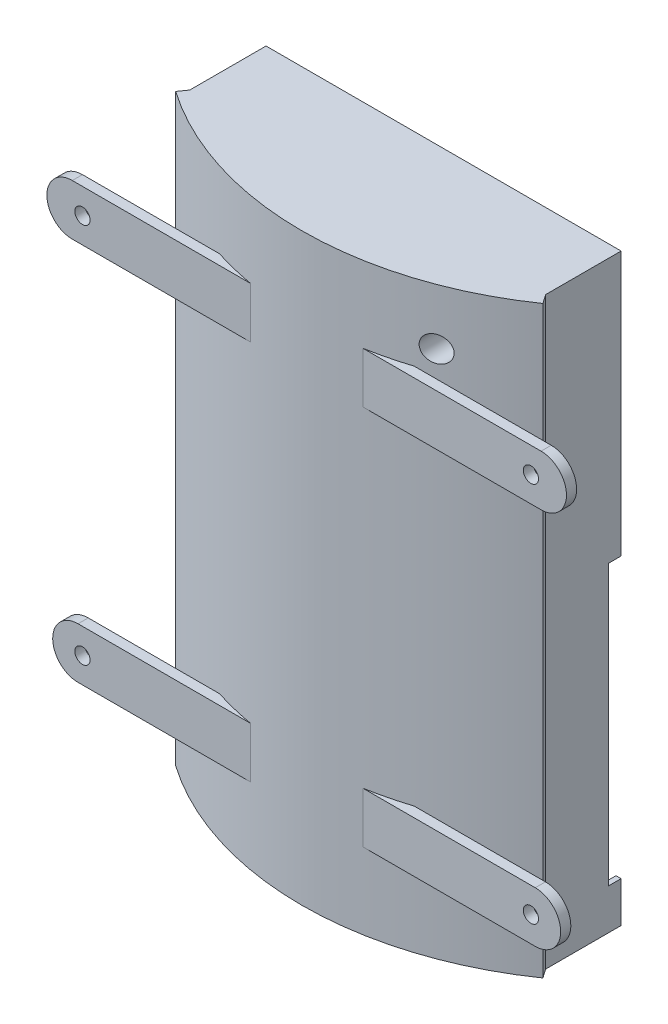
from build123d import *

# Parameters (mm, degrees)
SURFACE_EXTRUDE2_1_DEPTH = 115
THICKEN3_T2              = 2
BOSS_EXTRUDE2_REACH      = 890.848
SKETCH11_W               = 70
SKETCH11_H               = 115
BOSS_EXTRUDE7_DEPTH      = 2
SKETCH17_W               = 2.5
SKETCH17_H               = 115
BOSS_EXTRUDE8_DEPTH      = 15
SKETCH22_W               = 1.5
SKETCH22_H               = 105
CUT_EXTRUDE1_DEPTH       = 5
SKETCH23_W               = 64.9
SKETCH23_H               = 2
BOSS_EXTRUDE9_DEPTH      = 15
SKETCH25_W               = 64.9
SKETCH25_H               = 3.5
BOSS_EXTRUDE10_DEPTH     = 15
SKETCH26_W               = 20
SKETCH26_H               = 1.5
CUT_EXTRUDE3_DEPTH       = 15
SKETCH27_W               = 5
SKETCH27_H               = 9
CUT_EXTRUDE4_DEPTH       = 1.1
SKETCH29_W               = 2.5
SKETCH29_H               = 55
CUT_EXTRUDE6_DEPTH       = 1
CUT_EXTRUDE7_REACH       = 905.754
CUT_EXTRUDE7_END_RADIUS  = 63.3
SKETCH30_R               = 2.5
FILLET1_R                = 1
CUT_EXTRUDE8_REACH       = 909.037
SKETCH31_W               = 35
SKETCH31_H               = 3
CUT_EXTRUDE9_REACH       = 905.975
SKETCH32_R               = 1.5
SKETCH33_W               = 1.5
SKETCH33_H               = 5.890969975
BOSS_EXTRUDE11_DEPTH     = 1.5
MIRROR24_COPY_1_REACH    = 905.975
MIRROR24_COPY_1_SKETCH_R = 1.5


with BuildPart() as body_1:
    # Surface-Extrude2: a surface, the sketch's curves swept straight by 115 mm
    with BuildLine(Plane(origin=(0, 0, 0), x_dir=(1, 0, 0), z_dir=(0, 1, 0)), mode=Mode.PRIVATE) as surface_extrude2_1_path:
        ThreePointArc((-880.139667207, 63.554736355), (-845.139667207, 52.580574649), (-810.139667207, 63.554736355))
    surface_extrude2_1 = Shell.extrude(surface_extrude2_1_path.wire(), (0 * SURFACE_EXTRUDE2_1_DEPTH, 1 * SURFACE_EXTRUDE2_1_DEPTH, 0 * SURFACE_EXTRUDE2_1_DEPTH))
    add(Solid.thicken(surface_extrude2_1, -THICKEN3_T2))

    # Sketch11 → Boss-Extrude2 (add, up to next)
    with BuildSketch(Plane(origin=(0, 0, -63.554736355), x_dir=(-1, 0, 0), z_dir=(0, 0, -1)), mode=Mode.PRIVATE) as boss_extrude2_sk1:
        with Locations((845.139667207, 57.5)):
            Rectangle(SKETCH11_W, SKETCH11_H)
    boss_extrude2_tool1 = extrude(boss_extrude2_sk1.sketch, amount=-BOSS_EXTRUDE2_REACH, mode=Mode.PRIVATE) - body_1.part
    add(boss_extrude2_tool1.solids().sort_by_distance((-845.139667, 57.5, -63.554736))[0])

    # Sketch15 → Boss-Extrude7 (add)
    with BuildSketch(Plane(origin=(0, 0, -51.554736355), x_dir=(-1, 0, 0), z_dir=(0, 0, -1))):
        with BuildLine():
            Line((890.139667207, 24.998904399), (845.139667207, 24.998904399))
            Line((845.139667207, 24.998904399), (845.139667207, 15))
            Line((845.139667207, 15), (889.991644173, 15))
            ThreePointArc((889.991644173, 15), (895.139667207, 19.924336912), (890.139667207, 24.998904399))
        make_face()
        with BuildLine():
            Line((891.281592166, 100), (845.139667207, 100))
            Line((845.139667207, 100), (845.139667207, 90.00121851))
            Line((845.139667207, 90.00121851), (891.171212738, 90.00121851))
            ThreePointArc((891.171212738, 90.00121851), (896.281287529, 94.944806923), (891.281592166, 100))
        make_face()
    boss_extrude7 = extrude(amount=BOSS_EXTRUDE7_DEPTH)

    # Mirror20: Boss-Extrude7 across plane
    add(boss_extrude7.mirror(Plane.ZY.offset(845.139667207)))

    # Sketch17 → Boss-Extrude8 (add)
    with BuildSketch(Plane(origin=(0, 0, -63.554736355), x_dir=(-1, 0, 0), z_dir=(0, 0, -1))):
        with Locations((878.889667207, 57.5)):
            Rectangle(SKETCH17_W, SKETCH17_H)
        with Locations((811.489667207, 57.5)):
            Rectangle(SKETCH17_W, SKETCH17_H)
    extrude(amount=BOSS_EXTRUDE8_DEPTH)

    # Sketch22 → Cut-Extrude1 (cut)
    with BuildSketch(Plane(origin=(0, 0, -78.554736355), x_dir=(-1, 0, 0), z_dir=(0, 0, -1))):
        with Locations((811.989667207, 55.5)):
            Rectangle(SKETCH22_W, SKETCH22_H)
    cut_extrude1 = extrude(amount=-CUT_EXTRUDE1_DEPTH, mode=Mode.SUBTRACT)

    # Mirror21: Cut-Extrude1 across plane
    add(cut_extrude1.mirror(Plane.ZY.offset(845.139667207)), mode=Mode.SUBTRACT)

    # Sketch23 → Boss-Extrude9 (add)
    with BuildSketch(Plane(origin=(0, 0, -63.554736355), x_dir=(-1, 0, 0), z_dir=(0, 0, -1))):
        with Locations((845.189667207, 114)):
            Rectangle(SKETCH23_W, SKETCH23_H)
        with Locations((845.189667207, 110)):
            Rectangle(SKETCH23_W, SKETCH23_H)
    extrude(amount=BOSS_EXTRUDE9_DEPTH)

    # Sketch25 → Boss-Extrude10 (add)
    with BuildSketch(Plane(origin=(0, 0, -63.554736355), x_dir=(-1, 0, 0), z_dir=(0, 0, -1))):
        with Locations((845.189667207, 1.75)):
            Rectangle(SKETCH25_W, SKETCH25_H)
    extrude(amount=BOSS_EXTRUDE10_DEPTH)

    # Sketch26 → Cut-Extrude3 (cut)
    with BuildSketch(Plane(origin=(0, 0, -78.554736355), x_dir=(-1, 0, 0), z_dir=(0, 0, -1))):
        with Locations((825.239667207, 1.75)):
            Rectangle(SKETCH26_W, SKETCH26_H)
    extrude(amount=-CUT_EXTRUDE3_DEPTH, mode=Mode.SUBTRACT)

    # Sketch27 → Cut-Extrude4 (cut)
    with BuildSketch(Plane.ZY.offset(880.139667207)):
        with Locations((-75.146974965, 83)):
            Rectangle(SKETCH27_W, SKETCH27_H)
    extrude(amount=-CUT_EXTRUDE4_DEPTH, mode=Mode.SUBTRACT)

    # Sketch29 → Cut-Extrude6 (cut)
    with BuildSketch(Plane(origin=(-810.239667207, 0, 0), x_dir=(0, 0, -1), z_dir=(1, 0, 0))):
        with Locations((77.304736355, 35.5)):
            Rectangle(SKETCH29_W, SKETCH29_H)
    extrude(amount=-CUT_EXTRUDE6_DEPTH, mode=Mode.SUBTRACT)

    # Cut-Extrude7: up to this cylinder (the profile starts inside it)
    cut_extrude7_end = Plane(origin=(-845.139667207, 104, -113.880574649), z_dir=(0, 1, 0)) * Cylinder(CUT_EXTRUDE7_END_RADIUS, 1939.108, mode=Mode.PRIVATE)
    # Sketch30 → Cut-Extrude7 (cut, up to the surface)
    with BuildSketch(Plane(origin=(0, 0, -63.554736355), x_dir=(-1, 0, 0), z_dir=(0, 0, -1)), mode=Mode.PRIVATE) as cut_extrude7_sk1:
        with Locations((822.739667207, 104)):
            Circle(SKETCH30_R)
    cut_extrude7_tool1 = extrude(cut_extrude7_sk1.sketch, amount=-CUT_EXTRUDE7_REACH, mode=Mode.PRIVATE) & cut_extrude7_end
    add(cut_extrude7_tool1.solids().sort_by_distance((-822.739667, 104, -63.554736))[0], mode=Mode.SUBTRACT)

    # Fillet1
    fillet1_edges = [body_1.edges().sort_by_distance(p)[0] for p in [
        (-812.739667207, 3.5, -68.554736355),
        (-812.739667207, 109, -71.054736355),
        (-877.639667207, 109, -71.054736355),
        (-877.639667207, 3.5, -68.554736355),
        (-845.189667207, 3.5, -63.554736355),
        (-812.739667207, 56.25, -63.554736355),
        (-845.189667207, 109, -63.554736355),
        (-877.639667207, 56.25, -63.554736355),
    ]]
    fillet(fillet1_edges, radius=FILLET1_R - 0.0001)  # a hair under: the kernel refuses the full size

    # Sketch31 → Cut-Extrude8 (cut, up to next)
    with BuildSketch(Plane.XZ, mode=Mode.PRIVATE) as cut_extrude8_sk1:
        with Locations((-854.639667207, -77.054736355)):
            Rectangle(SKETCH31_W, SKETCH31_H)
    cut_extrude8_tool1 = extrude(cut_extrude8_sk1.sketch, amount=-CUT_EXTRUDE8_REACH, mode=Mode.PRIVATE) & body_1.part
    add(cut_extrude8_tool1.solids().sort_by_distance((-854.639667, 0, -77.054736))[0], mode=Mode.SUBTRACT)

    # Sketch32 → Cut-Extrude9 (cut, up to next)
    with BuildSketch(Plane(origin=(0, 0, -53.554736355), x_dir=(-1, 0, 0), z_dir=(0, 0, -1)), mode=Mode.PRIVATE) as cut_extrude9_sk1:
        with Locations((889.281592166, 95)):
            Circle(SKETCH32_R)
    cut_extrude9_tool1 = extrude(cut_extrude9_sk1.sketch, amount=-CUT_EXTRUDE9_REACH, mode=Mode.PRIVATE) & body_1.part
    cut_extrude9 = cut_extrude9_tool1.solids().sort_by_distance((-889.281592, 95, -53.554736))[0]
    add(cut_extrude9, mode=Mode.SUBTRACT)

    # Sketch33 → Boss-Extrude11 (add)
    with BuildSketch(Plane.ZY.offset(811.239667207)):
        with Locations((-76.504736355, 105.054515013)):
            Rectangle(SKETCH33_W, SKETCH33_H)
    boss_extrude11 = extrude(amount=BOSS_EXTRUDE11_DEPTH)

    # Mirror22: Boss-Extrude11 across plane
    add(boss_extrude11.mirror(Plane.ZY.offset(845.139667207)))

    # Mirror23: Cut-Extrude9 across plane
    add(cut_extrude9.mirror(Plane.ZY.offset(845.139667207)), mode=Mode.SUBTRACT)

    # Mirror24: Cut-Extrude9 across plane
    add(cut_extrude9.mirror(Plane.ZX.offset(57.5)), mode=Mode.SUBTRACT)

    # Mirror24 copy 1 sketch → Mirror24 copy 1 (cut, up to next)
    with BuildSketch(Plane(origin=(-1690.279334414, 115, -53.554736355), x_dir=(1, 0, 0), z_dir=(0, 0, -1)), mode=Mode.PRIVATE) as mirror24_copy_1_sk1:
        with Locations((889.281592166, 95)):
            Circle(MIRROR24_COPY_1_SKETCH_R)
    mirror24_copy_1_tool1 = extrude(mirror24_copy_1_sk1.sketch, amount=-MIRROR24_COPY_1_REACH, mode=Mode.PRIVATE) & body_1.part
    add(mirror24_copy_1_tool1.solids().sort_by_distance((-800.997742414, 20, -53.554736))[0], mode=Mode.SUBTRACT)


solid = body_1.part
